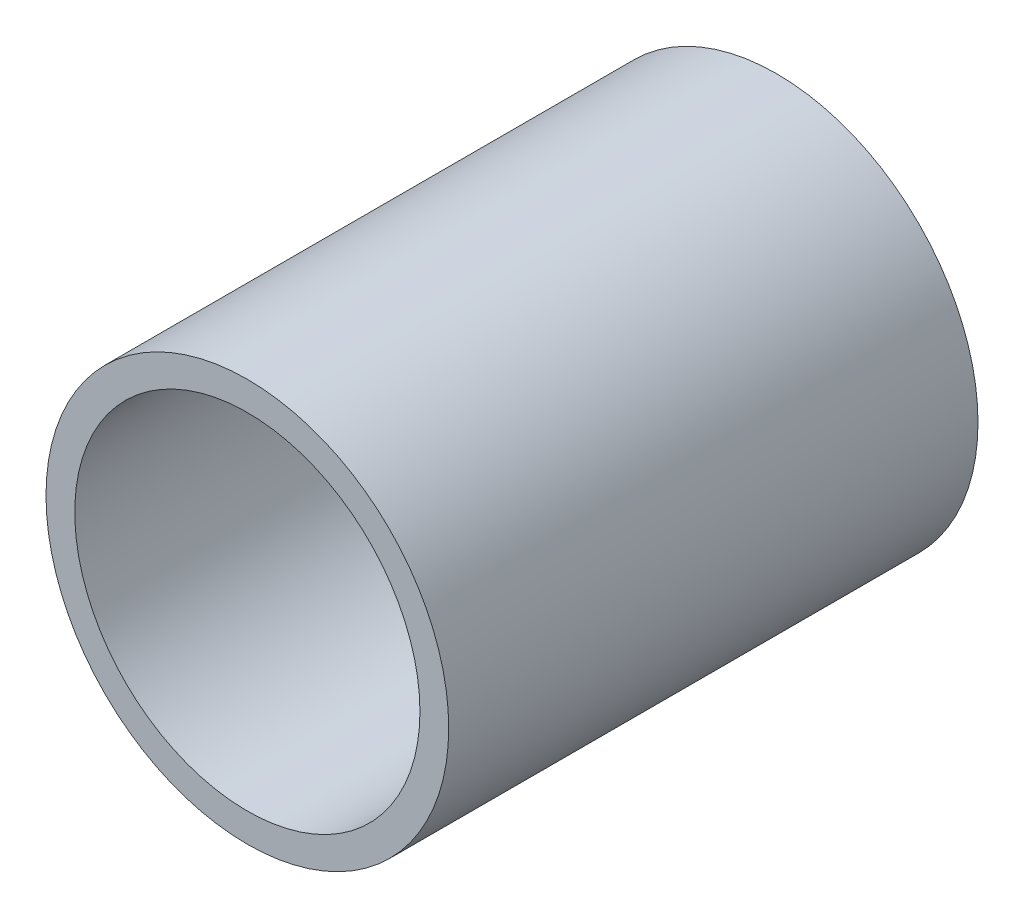
from build123d import *

# Parameters (mm, degrees)
SKIZZE1_R                       = 70
SKIZZE1_R_2                     = 60
AUFSATZ_LINEAR_AUSTRAGEN1_DEPTH = 184


with BuildPart() as part:
    # Skizze1 → Aufsatz-Linear austragen1 (new body)
    with BuildSketch(Plane(origin=(0, 0, 0), x_dir=(0, 1, 0), z_dir=(0, 0, 1))):
        Circle(SKIZZE1_R)
        Circle(SKIZZE1_R_2, mode=Mode.SUBTRACT)
    extrude(amount=-AUFSATZ_LINEAR_AUSTRAGEN1_DEPTH)


solid = part.part
